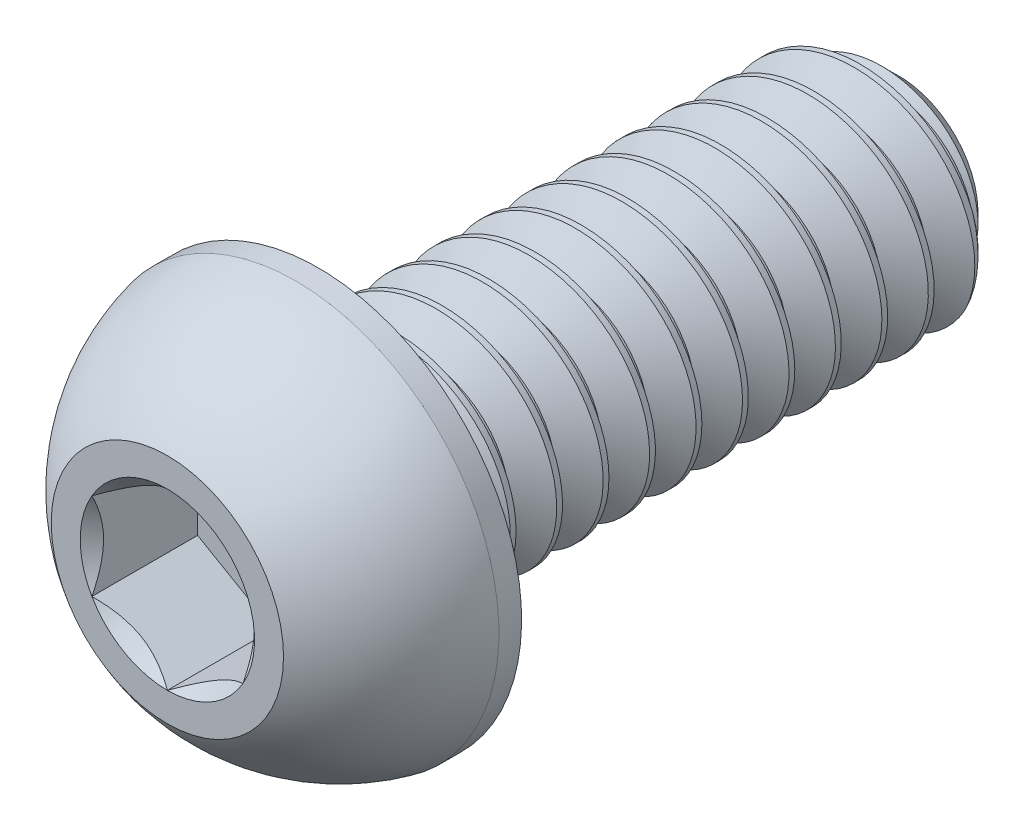
from build123d import *

# Parameters (mm, degrees)
CUT_EXTRUDE1_DEPTH = 0.91
CUT_SWEEP1_PITCH   = 0.4


# Read off the part's stored shape, not the designer's step: Split1
with BuildPart() as part:
    # Sketch2 → Revolve1 (revolve)
    with BuildSketch(Plane(origin=(0, 0, 0), x_dir=(0, 0, -1), z_dir=(1, 0, 0)), mode=Mode.PRIVATE) as revolve1_sk:
        with BuildLine():
            Line((-3.15, 0), (3.15, 0))
            Line((3.15, 0), (3.15, 0.68))
            Line((3.15, 0.68), (2.83, 1))
            Line((2.83, 1), (-1.85, 1))
            Line((-1.85, 1), (-1.85, 1.75))
            Line((-1.85, 1.75), (-2.045, 1.75))
            ThreePointArc((-2.045, 1.75), (-2.670023043, 1.481850617), (-3.15, 1))
            Line((-3.15, 1), (-3.15, 0))
        make_face()
    revolve(revolve1_sk.sketch.rotate(Axis((0, 0, 3.15), (0, 0, -1)), 180), axis=Axis((0, 0, 3.15), (0, 0, -1)))

    # Sketch3 → Cut-Extrude1 (cut)
    with BuildSketch(Plane.XY.offset(3.15)):
        Polygon((0, 0.75055535), (-0.65, 0.375277675), (-0.65, -0.375277675), (0, -0.75055535), (0.65, -0.375277675), (0.65, 0.375277675), align=None)
    extrude(amount=-CUT_EXTRUDE1_DEPTH, mode=Mode.SUBTRACT)

    # Cut-Extrude2 cone 1 section (through the dimple's axis) → Cut-Extrude2 (revolve, cut)
    with BuildSketch(Plane(origin=(0, 0, 3.15), x_dir=(0, -1, 0), z_dir=(1, 0, 0))):
        Polygon((0, 0), (0.75055535, 0), (0, 0.75055535), align=None)
    revolve(axis=Axis((0, 0, 3.15), (0, 0, -1)), mode=Mode.SUBTRACT)


with BuildPart() as body_2:
    # Split1: the piece on the far side of the plane
    add(part.part)
    split(bisect_by=Plane.XY.offset(1.85), keep=Keep.BOTTOM)

    # Cut-Sweep1: the profile of Sketch6 screwed along a right-hand helix of 13.5 turns, 6 arcs to a turn; built about Z, then put on its axis
    cut_sweep1_z = Axis((0, 0, 0), (0, 0, 1))
    cut_sweep1_corners = [(0.740192379, 0, -0.15), (0.740192379, 0, -0.2), (1.021650635, 0, -0.3625), (1.021650635, 0, 0.0125)]
    with BuildLine(mode=Mode.PRIVATE) as cut_sweep1_profile:
        Line(cut_sweep1_corners[0], cut_sweep1_corners[1])
        Line(cut_sweep1_corners[1], cut_sweep1_corners[2])
        Line(cut_sweep1_corners[2], cut_sweep1_corners[3])
        Line(cut_sweep1_corners[3], cut_sweep1_corners[0])
    cut_sweep1_cap = Face(cut_sweep1_profile.wire())
    cut_sweep1_turn_angles = [0, 30, 60, 90, 120, 150, 180, 210, 240, 270, 300, 330, 360]
    cut_sweep1_turn_weights = [1, 0.8660254037844387, 1, 0.8660254037844387, 1, 0.8660254037844387, 1, 0.8660254037844387, 1, 0.8660254037844387, 1, 0.8660254037844387, 1]
    cut_sweep1_turn_rails = [Edge.make_bspline([Vector(p[0], p[1], 0).rotate(cut_sweep1_z, cut_sweep1_turn_angles[k]) / cut_sweep1_turn_weights[k] + Vector(0, 0, p[2] + CUT_SWEEP1_PITCH * cut_sweep1_turn_angles[k] / 360) for k in range(13)], [0, 0, 0, 1, 1, 2, 2, 3, 3, 4, 4, 5, 5, 6, 6, 6], 2, cut_sweep1_turn_weights) for p in cut_sweep1_corners]
    cut_sweep1_turn_sides = [Face.make_surface_from_curves(cut_sweep1_turn_rails[p[0]], cut_sweep1_turn_rails[p[1]]) for p in [(0, 1), (1, 2), (2, 3), (3, 0)]]
    cut_sweep1_turn = Solid(Shell([*cut_sweep1_turn_sides, cut_sweep1_cap, cut_sweep1_cap.rotate(cut_sweep1_z, 360).moved(Location((0, 0, CUT_SWEEP1_PITCH * 360 / 360)))]))
    cut_sweep1_last_angles = [4680, 4710, 4740, 4770, 4800, 4830, 4860]
    cut_sweep1_last_weights = [1, 0.8660254037844387, 1, 0.8660254037844387, 1, 0.8660254037844188, 1]
    cut_sweep1_last_rails = [Edge.make_bspline([Vector(p[0], p[1], 0).rotate(cut_sweep1_z, cut_sweep1_last_angles[k]) / cut_sweep1_last_weights[k] + Vector(0, 0, p[2] + CUT_SWEEP1_PITCH * cut_sweep1_last_angles[k] / 360) for k in range(7)], [0, 0, 0, 1, 1, 2, 2, 3, 3, 3], 2, cut_sweep1_last_weights) for p in cut_sweep1_corners]
    cut_sweep1_last_sides = [Face.make_surface_from_curves(cut_sweep1_last_rails[p[0]], cut_sweep1_last_rails[p[1]]) for p in [(0, 1), (1, 2), (2, 3), (3, 0)]]
    cut_sweep1_last = Solid(Shell([*cut_sweep1_last_sides, cut_sweep1_cap.rotate(cut_sweep1_z, 4680).moved(Location((0, 0, CUT_SWEEP1_PITCH * 4680 / 360))), cut_sweep1_cap.rotate(cut_sweep1_z, 4860).moved(Location((0, 0, CUT_SWEEP1_PITCH * 4860 / 360)))]))
    cut_sweep1_each = [*[cut_sweep1_turn.moved(Location((0, 0, CUT_SWEEP1_PITCH * i))) for i in range(13)], cut_sweep1_last]
    add(Plane(origin=(0, 0, -3.15), x_dir=(0, 1, 0), z_dir=(0, 0, 1)) * Compound([cut_sweep1_each[i] for i in range(0, 14, 2)]), mode=Mode.SUBTRACT)
    add(Plane(origin=(0, 0, -3.15), x_dir=(0, 1, 0), z_dir=(0, 0, 1)) * Compound([cut_sweep1_each[i] for i in range(1, 14, 2)]), mode=Mode.SUBTRACT)


with BuildPart() as part_1:
    add(part.part)

    # Split1
    split(bisect_by=Plane.XY.offset(1.85), keep=Keep.TOP)

    add(body_2.part)  # Boss-Extrude1 merges body 2
    # Boss-Extrude1 cone 1 section (through the dimple's axis) → Boss-Extrude1 (revolve)
    with BuildSketch(Plane(origin=(0, 0, 1.85), x_dir=(0, -1, 0), z_dir=(1, 0, 0))):
        Polygon((0, 0), (1, 0), (0, 1.732050808), align=None)
    revolve(axis=Axis((0, 0, 1.85), (0, 0, -1)))


solid = part_1.part
